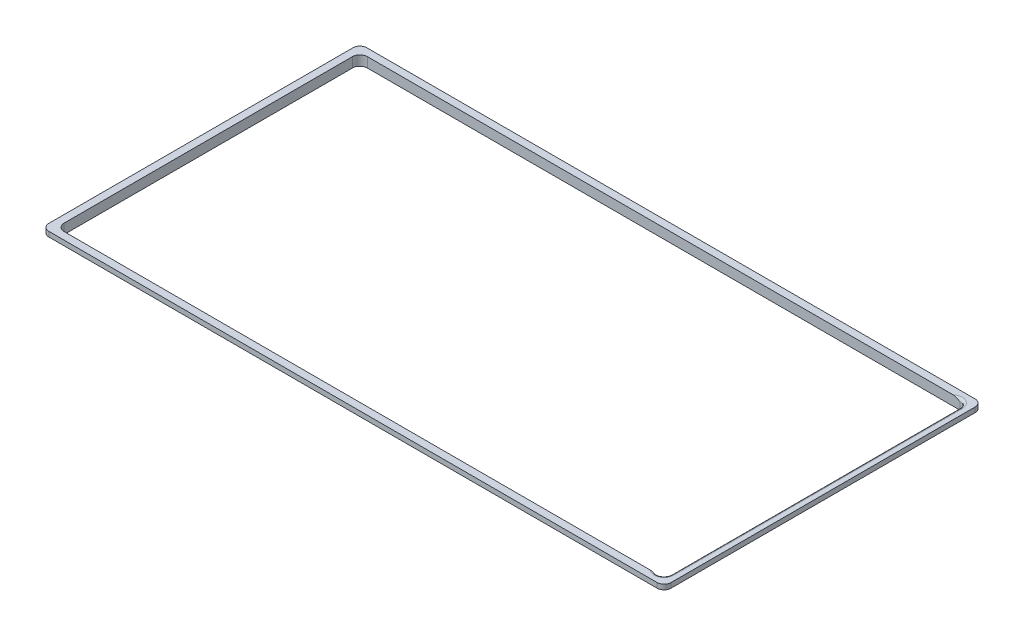
from build123d import *

# Parameters (mm, degrees)
AUFSATZ_LINEAR_AUSTRAGEN1_DEPTH = 2
AUFSATZ_LINEAR_START            = 2
AUFSATZ_LINEAR_AUSTRAGEN2_DEPTH = 2
SCHNITT_LINEAR_START            = -34
SCHNITT_LINEAR_AUSTRAGEN1_DEPTH = 34
VERRUNDUNG2_START               = 6.1999999
VERRUNDUNG2_3_DEPTH             = 116.6000001


with BuildPart() as part:
    # Skizze1 → Aufsatz-Linear austragen1 (new body)
    with BuildSketch(Plane(origin=(0, 0, 0), x_dir=(1, 0, 0), z_dir=(0, 1, 0))):
        with BuildLine():
            Line((3, 0), (249, 0))
            ThreePointArc((249, 0), (251.121320344, -0.878679656), (252, -3))
            Line((252, -3), (252, -126))
            ThreePointArc((252, -126), (251.121320344, -128.121320344), (249, -129))
            Line((249, -129), (3, -129))
            ThreePointArc((3, -129), (0.878679656, -128.121320344), (0, -126))
            Line((0, -126), (0, -3))
            ThreePointArc((0, -3), (0.878679656, -0.878679656), (3, 0))
        make_face()
        with BuildLine():
            Line((6.2, -3.2), (245.8, -3.2))
            ThreePointArc((245.8, -3.2), (247.921320344, -4.078679656), (248.8, -6.2))
            Line((248.8, -6.2), (248.8, -122.8))
            ThreePointArc((248.8, -122.8), (247.921320344, -124.921320344), (245.8, -125.8))
            Line((245.8, -125.8), (6.2, -125.8))
            ThreePointArc((6.2, -125.8), (4.078679656, -124.921320344), (3.2, -122.8))
            Line((3.2, -122.8), (3.2, -6.2))
            ThreePointArc((3.2, -6.2), (4.078679656, -4.078679656), (6.2, -3.2))
        make_face(mode=Mode.SUBTRACT)
    extrude(amount=AUFSATZ_LINEAR_AUSTRAGEN1_DEPTH)

    # Skizze2 → Aufsatz-Linear austragen2 (add)
    with BuildSketch(Plane.XZ.offset(AUFSATZ_LINEAR_START)):
        with BuildLine():
            Line((6.2, 126.8), (245.8, 126.8))
            ThreePointArc((245.8, 126.8), (248.628427125, 125.628427125), (249.8, 122.8))
            Line((249.8, 122.8), (249.8, 6.2))
            ThreePointArc((249.8, 6.2), (248.628427125, 3.371572875), (245.8, 2.2))
            Line((245.8, 2.2), (6.2, 2.2))
            ThreePointArc((6.2, 2.2), (3.371572875, 3.371572875), (2.2, 6.2))
            Line((2.2, 6.2), (2.2, 122.8))
            ThreePointArc((2.2, 122.8), (3.371572875, 125.628427125), (6.2, 126.8))
        make_face()
        with BuildLine():
            Line((248.8, 122.8), (248.8, 6.2))
            ThreePointArc((248.8, 6.2), (247.921320344, 4.078679656), (245.8, 3.2))
            Line((245.8, 3.2), (6.2, 3.2))
            ThreePointArc((6.2, 3.2), (4.078679656, 4.078679656), (3.2, 6.2))
            Line((3.2, 6.2), (3.2, 122.8))
            ThreePointArc((3.2, 122.8), (4.078679656, 124.921320344), (6.2, 125.8))
            Line((6.2, 125.8), (245.8, 125.8))
            ThreePointArc((245.8, 125.8), (247.921320344, 124.921320344), (248.8, 122.8))
        make_face(mode=Mode.SUBTRACT)
    extrude(amount=-AUFSATZ_LINEAR_AUSTRAGEN2_DEPTH)

    # Skizze3 → Schnitt-Linear austragen1 (cut)
    with BuildSketch(Plane(origin=(0, 2, 0), x_dir=(1, 0, 0), z_dir=(0, 1, 0)).offset(SCHNITT_LINEAR_START)):
        with BuildLine():
            Line((249, 0), (3, 0))
            ThreePointArc((3, 0), (0.878679656, -0.878679656), (0, -3))
            Line((0, -3), (0, -126))
            ThreePointArc((0, -126), (0.878679656, -128.121320344), (3, -129))
            Line((3, -129), (249, -129))
            ThreePointArc((249, -129), (251.121320344, -128.121320344), (252, -126))
            Line((252, -126), (252, -3))
            ThreePointArc((252, -3), (251.121320344, -0.878679656), (249, 0))
        make_face()
        with BuildLine():
            Line((249, -0.2), (3, -0.2))
            ThreePointArc((3, -0.2), (1.020101013, -1.020101013), (0.2, -3))
            Line((0.2, -3), (0.2, -126))
            ThreePointArc((0.2, -126), (1.020101013, -127.979898987), (3, -128.8))
            Line((3, -128.8), (249, -128.8))
            ThreePointArc((249, -128.8), (250.979898987, -127.979898987), (251.8, -126))
            Line((251.8, -126), (251.8, -3))
            ThreePointArc((251.8, -3), (250.979898987, -1.020101013), (249, -0.2))
        make_face(mode=Mode.SUBTRACT)
    extrude(amount=SCHNITT_LINEAR_AUSTRAGEN1_DEPTH, mode=Mode.SUBTRACT)

    # Verrundung2: read off the stored shape, not the designer's step
    # Verrundung2 outline → Verrundung2 (revolve, cut)
    with BuildSketch(Plane(origin=(245.8, 0, 122.8), x_dir=(1, 0, 0), z_dir=(0, 0, 1))):
        with BuildLine():
            Line((3, 2), (3, 1))
            ThreePointArc((3, 1), (3.292893219, 1.707106781), (4, 2))
            Line((4, 2), (3, 2))
        make_face()
    revolve(axis=Axis((245.8, 0, 122.8), (0, 1, 0)), mode=Mode.SUBTRACT)

    # Verrundung2 2 outline → Verrundung2 2 (revolve, cut)
    with BuildSketch(Plane(origin=(245.8, 0, 6.2), x_dir=(1, 0, 0), z_dir=(0, 0, 1))):
        with BuildLine():
            Line((3, 2), (3, 1))
            ThreePointArc((3, 1), (3.292893219, 1.707106781), (4, 2))
            Line((4, 2), (3, 2))
        make_face()
    revolve(axis=Axis((245.8, 0, 6.2), (0, 1, 0)), mode=Mode.SUBTRACT)

    # Verrundung2 3 outline → Verrundung2 3 (cut)
    with BuildSketch(Plane.XY.offset(VERRUNDUNG2_START)):
        with BuildLine():
            ThreePointArc((248.8, 1), (249.092893219, 1.707106781), (249.8, 2))
            Line((249.8, 2), (248.8, 2))
            Line((248.8, 2), (248.8, 1))
        make_face()
    extrude(amount=VERRUNDUNG2_3_DEPTH, mode=Mode.SUBTRACT)


solid = part.part
